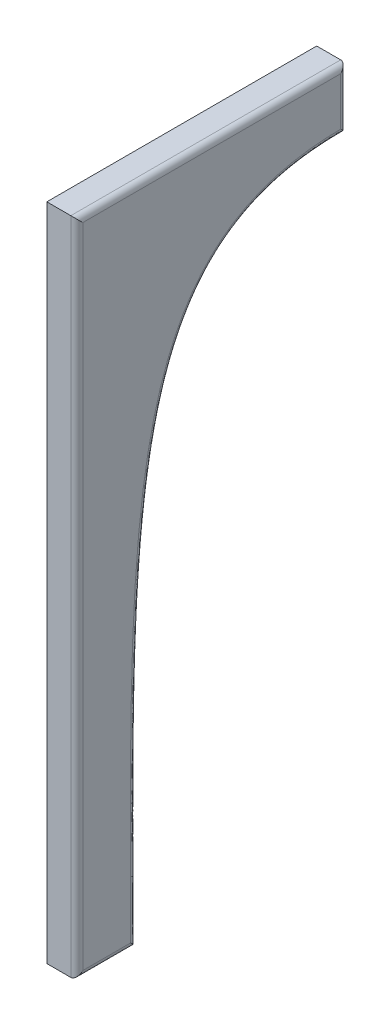
from build123d import *

# Parameters (mm, degrees)
BOSS_EXTRUDE1_DEPTH = 12.7
FILLET1_R           = 2.54


with BuildPart() as part:
    # Sketch1 → Boss-Extrude1 (new body)
    with BuildSketch(Plane(origin=(0, 0, 0), x_dir=(0, 0, -1), z_dir=(1, 0, 0))):
        with BuildLine():
            Line((0, 0), (0, 279.4))
            Line((0, 279.4), (114.3, 279.4))
            Line((114.3, 279.4), (114.3, 254))
            add(Edge.make_bspline(
                [(25.4, 0), (24.239409863, 172.867425699), (24.601191912, 254.838281825), (114.3, 254)],
                knots=[0, 0, 0, 0, 1, 1, 1, 1], degree=3))
            Line((25.4, 0), (0, 0))
        make_face()
    extrude(amount=BOSS_EXTRUDE1_DEPTH)

    # Fillet1
    fillet1_edges = [part.edges().sort_by_distance(p)[0] for p in [
        (12.7, 266.7, -114.3),
        (12.7, 279.4, -57.15),
        (12.7, 139.7, 0),
        (12.7, 0, -12.7),
        (12.7, 192.139640321, -35.777725666),
    ]]
    fillet(fillet1_edges, radius=FILLET1_R - 0.0001)  # a hair under: the kernel refuses the full size


solid = part.part
